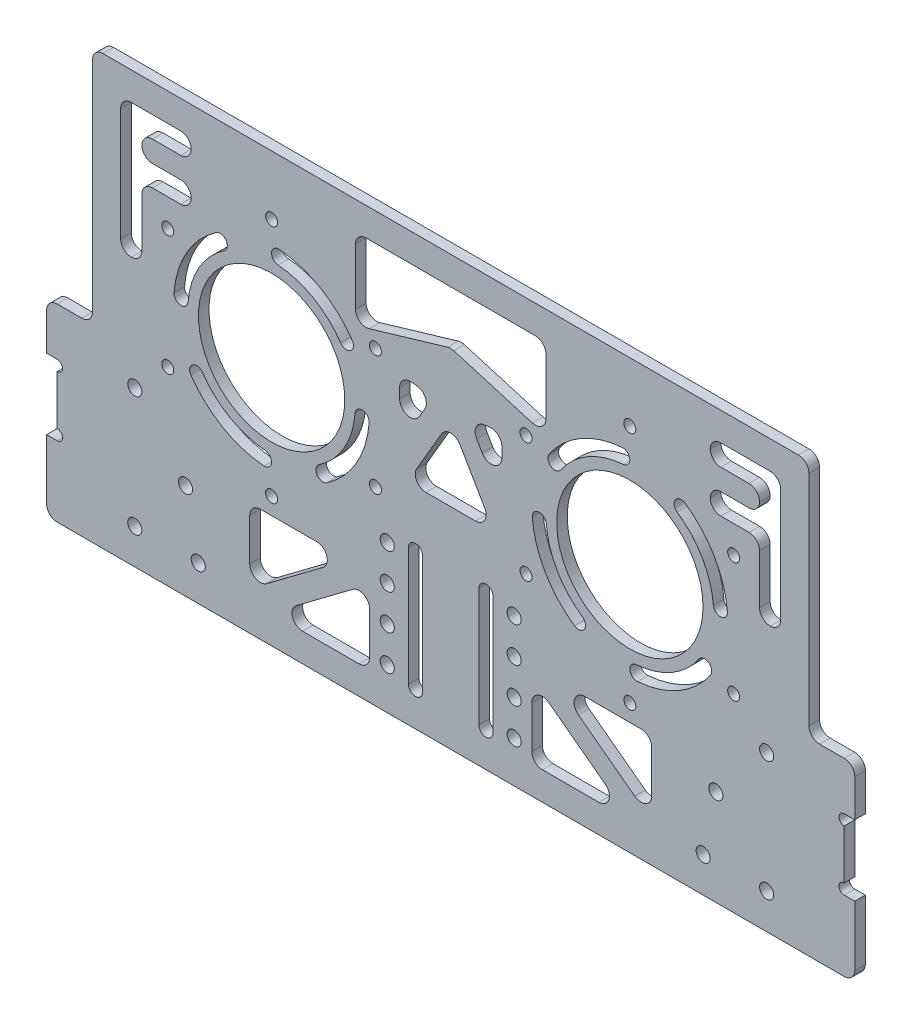
from build123d import *

# Parameters (mm, degrees)
SKETCH_1_W          = 203.2
SKETCH_1_H          = 121.6
EXTRUDE_1_DEPTH     = 3
CUT_EXTRUDE_1_REACH = 120.441
SKETCH_5_R          = 20.75
SKETCH_5_R_2        = 1.7
SKETCH_6_W          = 3
SKETCH_6_H          = 53.59
EXTRUDE_2_DEPTH     = 13
SKETCH_7_W          = 3
SKETCH_7_H          = 53.59
EXTRUDE_3_DEPTH     = 13
FILLET_1_R          = 3
SKETCH_9_R          = 2
CUT_EXTRUDE_2_DEPTH = 130.764401898
FILLET_2_R          = 3
CUT_EXTRUDE_3_DEPTH = 130.764401898
FILLET_3_R          = 3


with BuildPart() as part:
    # 草图1 → 凸台-拉伸1 (new body)
    with BuildSketch(Plane.XY):
        Rectangle(SKETCH_1_W, SKETCH_1_H)
    extrude(amount=-EXTRUDE_1_DEPTH)

    # 草图5 → 切除-拉伸1 (cut, up to next)
    with BuildSketch(Plane.XY, mode=Mode.PRIVATE) as cut_extrude_1_sk1:
        with Locations((-50.8, 10)):
            Circle(SKETCH_5_R)
    cut_extrude_1_tool1 = extrude(cut_extrude_1_sk1.sketch, amount=-CUT_EXTRUDE_1_REACH, mode=Mode.PRIVATE) & part.part
    # 草图5 → 切除-拉伸1 (cut, up to next)
    with BuildSketch(Plane.XY, mode=Mode.PRIVATE) as cut_extrude_1_sk2:
        with Locations((50.8, 10)):
            Circle(SKETCH_5_R)
    cut_extrude_1_tool2 = extrude(cut_extrude_1_sk2.sketch, amount=-CUT_EXTRUDE_1_REACH, mode=Mode.PRIVATE) & part.part
    # 草图5 → 切除-拉伸1 (cut, up to next)
    with BuildSketch(Plane.XY, mode=Mode.PRIVATE) as cut_extrude_1_sk3:
        with Locations((-50.8, 44.000079294)):
            Circle(SKETCH_5_R_2)
    cut_extrude_1_tool3 = extrude(cut_extrude_1_sk3.sketch, amount=-CUT_EXTRUDE_1_REACH, mode=Mode.PRIVATE) & part.part
    # 草图5 → 切除-拉伸1 (cut, up to next)
    with BuildSketch(Plane.XY, mode=Mode.PRIVATE) as cut_extrude_1_sk4:
        with Locations((-21.3550676, 27.000039647)):
            Circle(SKETCH_5_R_2)
    cut_extrude_1_tool4 = extrude(cut_extrude_1_sk4.sketch, amount=-CUT_EXTRUDE_1_REACH, mode=Mode.PRIVATE) & part.part
    # 草图5 → 切除-拉伸1 (cut, up to next)
    with BuildSketch(Plane.XY, mode=Mode.PRIVATE) as cut_extrude_1_sk5:
        with Locations((-21.3550676, -7.000039647)):
            Circle(SKETCH_5_R_2)
    cut_extrude_1_tool5 = extrude(cut_extrude_1_sk5.sketch, amount=-CUT_EXTRUDE_1_REACH, mode=Mode.PRIVATE) & part.part
    # 草图5 → 切除-拉伸1 (cut, up to next)
    with BuildSketch(Plane.XY, mode=Mode.PRIVATE) as cut_extrude_1_sk6:
        with Locations((-50.8, -24.000079294)):
            Circle(SKETCH_5_R_2)
    cut_extrude_1_tool6 = extrude(cut_extrude_1_sk6.sketch, amount=-CUT_EXTRUDE_1_REACH, mode=Mode.PRIVATE) & part.part
    # 草图5 → 切除-拉伸1 (cut, up to next)
    with BuildSketch(Plane.XY, mode=Mode.PRIVATE) as cut_extrude_1_sk7:
        with Locations((-80.2449324, -7.000039647)):
            Circle(SKETCH_5_R_2)
    cut_extrude_1_tool7 = extrude(cut_extrude_1_sk7.sketch, amount=-CUT_EXTRUDE_1_REACH, mode=Mode.PRIVATE) & part.part
    # 草图5 → 切除-拉伸1 (cut, up to next)
    with BuildSketch(Plane.XY, mode=Mode.PRIVATE) as cut_extrude_1_sk8:
        with Locations((-80.2449324, 27.000039647)):
            Circle(SKETCH_5_R_2)
    cut_extrude_1_tool8 = extrude(cut_extrude_1_sk8.sketch, amount=-CUT_EXTRUDE_1_REACH, mode=Mode.PRIVATE) & part.part
    # 草图5 → 切除-拉伸1 (cut, up to next)
    with BuildSketch(Plane.XY, mode=Mode.PRIVATE) as cut_extrude_1_sk9:
        with Locations((50.8, 44)):
            Circle(SKETCH_5_R_2)
    cut_extrude_1_tool9 = extrude(cut_extrude_1_sk9.sketch, amount=-CUT_EXTRUDE_1_REACH, mode=Mode.PRIVATE) & part.part
    # 草图5 → 切除-拉伸1 (cut, up to next)
    with BuildSketch(Plane.XY, mode=Mode.PRIVATE) as cut_extrude_1_sk10:
        with Locations((80.244863729, 27)):
            Circle(SKETCH_5_R_2)
    cut_extrude_1_tool10 = extrude(cut_extrude_1_sk10.sketch, amount=-CUT_EXTRUDE_1_REACH, mode=Mode.PRIVATE) & part.part
    # 草图5 → 切除-拉伸1 (cut, up to next)
    with BuildSketch(Plane.XY, mode=Mode.PRIVATE) as cut_extrude_1_sk11:
        with Locations((80.244863729, -7)):
            Circle(SKETCH_5_R_2)
    cut_extrude_1_tool11 = extrude(cut_extrude_1_sk11.sketch, amount=-CUT_EXTRUDE_1_REACH, mode=Mode.PRIVATE) & part.part
    # 草图5 → 切除-拉伸1 (cut, up to next)
    with BuildSketch(Plane.XY, mode=Mode.PRIVATE) as cut_extrude_1_sk12:
        with Locations((50.8, -24)):
            Circle(SKETCH_5_R_2)
    cut_extrude_1_tool12 = extrude(cut_extrude_1_sk12.sketch, amount=-CUT_EXTRUDE_1_REACH, mode=Mode.PRIVATE) & part.part
    # 草图5 → 切除-拉伸1 (cut, up to next)
    with BuildSketch(Plane.XY, mode=Mode.PRIVATE) as cut_extrude_1_sk13:
        with Locations((21.355136271, -7)):
            Circle(SKETCH_5_R_2)
    cut_extrude_1_tool13 = extrude(cut_extrude_1_sk13.sketch, amount=-CUT_EXTRUDE_1_REACH, mode=Mode.PRIVATE) & part.part
    # 草图5 → 切除-拉伸1 (cut, up to next)
    with BuildSketch(Plane.XY, mode=Mode.PRIVATE) as cut_extrude_1_sk14:
        with Locations((21.355136271, 27)):
            Circle(SKETCH_5_R_2)
    cut_extrude_1_tool14 = extrude(cut_extrude_1_sk14.sketch, amount=-CUT_EXTRUDE_1_REACH, mode=Mode.PRIVATE) & part.part
    add(cut_extrude_1_tool1.solids().sort_by_distance((-50.8, 10, 0))[0], mode=Mode.SUBTRACT)
    add(cut_extrude_1_tool2.solids().sort_by_distance((50.8, 10, 0))[0], mode=Mode.SUBTRACT)
    add(cut_extrude_1_tool3.solids().sort_by_distance((-50.8, 44.000079, 0))[0], mode=Mode.SUBTRACT)
    add(cut_extrude_1_tool4.solids().sort_by_distance((-21.355068, 27.00004, 0))[0], mode=Mode.SUBTRACT)
    add(cut_extrude_1_tool5.solids().sort_by_distance((-21.355068, -7.00004, 0))[0], mode=Mode.SUBTRACT)
    add(cut_extrude_1_tool6.solids().sort_by_distance((-50.8, -24.000079, 0))[0], mode=Mode.SUBTRACT)
    add(cut_extrude_1_tool7.solids().sort_by_distance((-80.244932, -7.00004, 0))[0], mode=Mode.SUBTRACT)
    add(cut_extrude_1_tool8.solids().sort_by_distance((-80.244932, 27.00004, 0))[0], mode=Mode.SUBTRACT)
    add(cut_extrude_1_tool9.solids().sort_by_distance((50.8, 44, 0))[0], mode=Mode.SUBTRACT)
    add(cut_extrude_1_tool10.solids().sort_by_distance((80.244864, 27, 0))[0], mode=Mode.SUBTRACT)
    add(cut_extrude_1_tool11.solids().sort_by_distance((80.244864, -7, 0))[0], mode=Mode.SUBTRACT)
    add(cut_extrude_1_tool12.solids().sort_by_distance((50.8, -24, 0))[0], mode=Mode.SUBTRACT)
    add(cut_extrude_1_tool13.solids().sort_by_distance((21.355136, -7, 0))[0], mode=Mode.SUBTRACT)
    add(cut_extrude_1_tool14.solids().sort_by_distance((21.355136, 27, 0))[0], mode=Mode.SUBTRACT)

    # 草图6 → 凸台-拉伸2 (add)
    with BuildSketch(Plane.ZY.offset(101.6)):
        with Locations((-1.5, -34.005)):
            Rectangle(SKETCH_6_W, SKETCH_6_H)
    extrude(amount=EXTRUDE_2_DEPTH)

    # 草图7 → 凸台-拉伸3 (add)
    with BuildSketch(Plane(origin=(101.6, 0, 0), x_dir=(0, 0, -1), z_dir=(1, 0, 0))):
        with Locations((1.5, -34.005)):
            Rectangle(SKETCH_7_W, SKETCH_7_H)
    extrude(amount=EXTRUDE_3_DEPTH)

    # 圆角1
    fillet_1_edges = [part.edges().sort_by_distance(p)[0] for p in [
        (-101.6, -7.21, -1.5),
        (-101.6, 60.8, -1.5),
        (101.6, 60.8, -1.5),
        (101.6, -7.21, -1.5),
    ]]
    fillet(fillet_1_edges, radius=FILLET_1_R)

    # 草图9 → 切除-拉伸2 (cut, through all)
    with BuildSketch(Plane(origin=(0, 0, -3), x_dir=(-1, 0, 0), z_dir=(0, 0, -1))):
        with Locations((71.6, -50.8)):
            Circle(SKETCH_9_R)
        with Locations((75.189185504, -33.621628993)):
            Circle(SKETCH_9_R)
        with Locations((89.6, -16.8)):
            Circle(SKETCH_9_R)
        with Locations((18, -19.005089604)):
            Circle(SKETCH_9_R)
        with Locations((18, -29.005089604)):
            Circle(SKETCH_9_R)
        with Locations((18, -39.005089604)):
            Circle(SKETCH_9_R)
        with Locations((18, -49.005089604)):
            Circle(SKETCH_9_R)
        with Locations((-18, -49.005089604)):
            Circle(SKETCH_9_R)
        with Locations((-18, -39.005089604)):
            Circle(SKETCH_9_R)
        with Locations((-18, -19.005089604)):
            Circle(SKETCH_9_R)
        with Locations((-18, -29.005089604)):
            Circle(SKETCH_9_R)
        with Locations((-71.6, -50.8)):
            Circle(SKETCH_9_R)
        with Locations((-75.189185504, -33.621628993)):
            Circle(SKETCH_9_R)
        with Locations((-89.6, -16.8)):
            Circle(SKETCH_9_R)
        with Locations((-89.6, -50.8)):
            Circle(SKETCH_9_R)
        with Locations((89.6, -50.8)):
            Circle(SKETCH_9_R)
        Polygon((0, 19.846095433), (12.276889003, -1.2), (-12.276889003, -1.2), align=None)
        Polygon((-27, 52.8), (27, 52.8), (27, 29.815583262), (0, 37.8), (-27, 29.815583262), align=None)
        Polygon((-93.6, 14.8), (-93.6, 52.8), (-73.6, 52.8), (-73.6, 46.8), (-87.6, 46.8), (-87.6, 40.8), (-73.6, 40.8), (-73.6, 34.8), (-87.6, 34.8), (-87.6, 14.8), align=None)
        with BuildLine():
            Line((38, -28.8), (54, -28.8))
            ThreePointArc((54, -28.8), (56.121320344, -29.678679656), (57, -31.8))
            Line((57, -31.8), (57, -43.8))
            ThreePointArc((57, -43.8), (55.341640786, -46.483281573), (52.2, -46.2))
            Line((52.2, -46.2), (36.2, -34.2))
            ThreePointArc((36.2, -34.2), (35.153950106, -30.851316702), (38, -28.8))
        make_face()
        with BuildLine():
            Line((23, -49.8), (23, -37.8))
            ThreePointArc((23, -37.8), (24.658359214, -35.116718427), (27.8, -35.4))
            Line((27.8, -35.4), (43.8, -47.4))
            ThreePointArc((43.8, -47.4), (44.846049894, -50.748683298), (42, -52.8))
            Line((42, -52.8), (26, -52.8))
            ThreePointArc((26, -52.8), (23.878679656, -51.921320344), (23, -49.8))
        make_face()
        with BuildLine():
            Line((12, -17.210179208), (12, -50.8))
            ThreePointArc((12, -50.8), (10, -52.8), (8, -50.8))
            Line((8, -50.8), (8, -17.210179208))
            ThreePointArc((8, -17.210179208), (10, -15.210179208), (12, -17.210179208))
        make_face()
        with BuildLine():
            Line((-8, -17.210179208), (-8, -50.8))
            ThreePointArc((-8, -50.8), (-10, -52.8), (-12, -50.8))
            Line((-12, -50.8), (-12, -17.210179208))
            ThreePointArc((-12, -17.210179208), (-10, -15.210179208), (-8, -17.210179208))
        make_face()
        with BuildLine():
            Line((-26, -52.8), (-42, -52.8))
            ThreePointArc((-42, -52.8), (-44.846049894, -50.748683298), (-43.8, -47.4))
            Line((-43.8, -47.4), (-27.8, -35.4))
            ThreePointArc((-27.8, -35.4), (-24.658359214, -35.116718427), (-23, -37.8))
            Line((-23, -37.8), (-23, -49.8))
            ThreePointArc((-23, -49.8), (-23.878679656, -51.921320344), (-26, -52.8))
        make_face()
        with BuildLine():
            Line((-54, -28.8), (-38, -28.8))
            ThreePointArc((-38, -28.8), (-35.153950106, -30.851316702), (-36.2, -34.2))
            Line((-36.2, -34.2), (-52.2, -46.2))
            ThreePointArc((-52.2, -46.2), (-55.341640786, -46.483281573), (-57, -43.8))
            Line((-57, -43.8), (-57, -31.8))
            ThreePointArc((-57, -31.8), (-56.121320344, -29.678679656), (-54, -28.8))
        make_face()
        Polygon((14.5, 6.89676171), (14.5, 24.158507917), (4.957323726, 23.255635323), align=None)
        Polygon((-4.957323726, 23.255635323), (-14.5, 24.158507917), (-14.5, 6.89676171), align=None)
        Polygon((87.6, 14.8), (93.6, 14.8), (93.6, 52.8), (73.6, 52.8), (73.6, 46.8), (87.6, 46.8), (87.6, 40.8), (73.6, 40.8), (73.6, 34.8), (87.6, 34.8), align=None)
        with BuildLine():
            ThreePointArc((-37.363350239, -9.583639682), (-30.23189666, -1.875), (-27.121745656, 8.155339806))
            ThreePointArc((-27.121745656, 8.155339806), (-24.97244759, 9.993958261), (-23.133829135, 7.844660194))
            ThreePointArc((-23.133829135, 7.844660194), (-26.767795045, -3.875), (-35.100335542, -12.881936891))
            ThreePointArc((-35.100335542, -12.881936891), (-37.880991495, -12.364295635), (-37.363350239, -9.583639682))
        make_face()
        with BuildLine():
            ThreePointArc((-31.216360318, 23.436649761), (-38.925, 30.56810334), (-48.955339806, 33.678254344))
            ThreePointArc((-48.955339806, 33.678254344), (-50.793958261, 35.82755241), (-48.644660194, 37.666170865))
            ThreePointArc((-48.644660194, 37.666170865), (-36.925, 34.032204955), (-27.918063109, 25.699664458))
            ThreePointArc((-27.918063109, 25.699664458), (-28.435704365, 22.919008505), (-31.216360318, 23.436649761))
        make_face()
        with BuildLine():
            ThreePointArc((73.681936891, -5.699664458), (73.164295635, -2.919008505), (70.383639682, -3.436649761))
            ThreePointArc((70.383639682, -3.436649761), (62.675, -10.56810334), (52.644660194, -13.678254344))
            ThreePointArc((52.644660194, -13.678254344), (50.806041739, -15.82755241), (52.955339806, -17.666170865))
            ThreePointArc((52.955339806, -17.666170865), (64.675, -14.032204955), (73.681936891, -5.699664458))
        make_face()
        with BuildLine():
            ThreePointArc((-70.383639682, -3.436649761), (-62.675, -10.56810334), (-52.644660194, -13.678254344))
            ThreePointArc((-52.644660194, -13.678254344), (-50.806041739, -15.82755241), (-52.955339806, -17.666170865))
            ThreePointArc((-52.955339806, -17.666170865), (-64.675, -14.032204955), (-73.681936891, -5.699664458))
            ThreePointArc((-73.681936891, -5.699664458), (-73.164295635, -2.919008505), (-70.383639682, -3.436649761))
        make_face()
        with BuildLine():
            ThreePointArc((-64.236649761, 29.583639682), (-71.36810334, 21.875), (-74.478254344, 11.844660194))
            ThreePointArc((-74.478254344, 11.844660194), (-76.62755241, 10.006041739), (-78.466170865, 12.155339806))
            ThreePointArc((-78.466170865, 12.155339806), (-74.832204955, 23.875), (-66.499664458, 32.881936891))
            ThreePointArc((-66.499664458, 32.881936891), (-63.719008505, 32.364295635), (-64.236649761, 29.583639682))
        make_face()
        with BuildLine():
            ThreePointArc((35.100335542, -12.881936891), (37.880991495, -12.364295635), (37.363350239, -9.583639682))
            ThreePointArc((37.363350239, -9.583639682), (30.23189666, -1.875), (27.121745656, 8.155339806))
            ThreePointArc((27.121745656, 8.155339806), (24.97244759, 9.993958261), (23.133829135, 7.844660194))
            ThreePointArc((23.133829135, 7.844660194), (26.767795045, -3.875), (35.100335542, -12.881936891))
        make_face()
        with BuildLine():
            ThreePointArc((27.918063109, 25.699664458), (28.435704365, 22.919008505), (31.216360318, 23.436649761))
            ThreePointArc((31.216360318, 23.436649761), (38.925, 30.56810334), (48.955339806, 33.678254344))
            ThreePointArc((48.955339806, 33.678254344), (50.793958261, 35.82755241), (48.644660194, 37.666170865))
            ThreePointArc((48.644660194, 37.666170865), (36.925, 34.032204955), (27.918063109, 25.699664458))
        make_face()
        with BuildLine():
            ThreePointArc((66.499664458, 32.881936891), (63.719008505, 32.364295635), (64.236649761, 29.583639682))
            ThreePointArc((64.236649761, 29.583639682), (71.36810334, 21.875), (74.478254344, 11.844660194))
            ThreePointArc((74.478254344, 11.844660194), (76.62755241, 10.006041739), (78.466170865, 12.155339806))
            ThreePointArc((78.466170865, 12.155339806), (74.832204955, 23.875), (66.499664458, 32.881936891))
        make_face()
    extrude(amount=-CUT_EXTRUDE_2_DEPTH, mode=Mode.SUBTRACT)

    # 圆角2
    fillet_2_edges = [part.edges().sort_by_distance(p)[0] for p in [
        (-14.5, 6.89676171, -1.5),
        (-4.957323726, 23.255635323, -1.5),
        (-14.5, 24.158507917, -1.5),
        (4.957323726, 23.255635323, -1.5),
        (14.5, 24.158507917, -1.5),
        (14.5, 6.89676171, -1.5),
        (12.276889003, -1.2, -1.5),
        (-12.276889003, -1.2, -1.5),
        (-93.6, 14.8, -1.5),
        (-87.6, 14.8, -1.5),
        (-73.6, 40.8, -1.5),
        (-87.6, 34.8, -1.5),
        (-73.6, 34.8, -1.5),
        (-87.6, 40.8, -1.5),
        (-87.6, 46.8, -1.5),
        (-73.6, 46.8, -1.5),
        (-73.6, 52.8, -1.5),
        (-93.6, 52.8, -1.5),
        (-27, 52.8, -1.5),
        (-27, 29.815583262, -1.5),
        (0, 37.8, -1.5),
        (27, 29.815583262, -1.5),
        (27, 52.8, -1.5),
        (93.6, 52.8, -1.5),
        (87.6, 46.8, -1.5),
        (73.6, 46.8, -1.5),
        (73.6, 52.8, -1.5),
        (73.6, 40.8, -1.5),
        (73.6, 34.8, -1.5),
        (87.6, 40.8, -1.5),
        (87.6, 34.8, -1.5),
        (87.6, 14.8, -1.5),
        (93.6, 14.8, -1.5),
        (0, 19.846095433, -1.5),
    ]]
    fillet(fillet_2_edges, radius=FILLET_2_R - 0.0001)  # a hair under: the kernel refuses the full size

    # 草图10 → 切除-拉伸3 (cut, through all)
    with BuildSketch(Plane.XY):
        with BuildLine():
            Line((-114.6, -20.8), (-111.6, -20.8))
            ThreePointArc((-111.6, -20.8), (-110.1, -22.3), (-111.6, -23.8))
            Line((-111.6, -23.8), (-111.6, -37.8))
            ThreePointArc((-111.6, -37.8), (-110.1, -39.3), (-111.6, -40.8))
            Line((-111.6, -40.8), (-114.6, -40.8))
            Line((-114.6, -40.8), (-114.6, -20.8))
        make_face()
        with BuildLine():
            Line((114.6, -20.8), (114.6, -40.8))
            Line((114.6, -40.8), (111.6, -40.8))
            ThreePointArc((111.6, -40.8), (110.1, -39.3), (111.6, -37.8))
            Line((111.6, -37.8), (111.6, -23.8))
            ThreePointArc((111.6, -23.8), (110.1, -22.3), (111.6, -20.8))
            Line((111.6, -20.8), (114.6, -20.8))
        make_face()
    extrude(amount=-CUT_EXTRUDE_3_DEPTH, mode=Mode.SUBTRACT)

    # 圆角3
    fillet_3_edges = [part.edges().sort_by_distance(p)[0] for p in [
        (-114.6, -60.8, -1.5),
        (-114.6, -7.21, -1.5),
        (114.6, -60.8, -1.5),
        (114.6, -7.21, -1.5),
    ]]
    fillet(fillet_3_edges, radius=FILLET_3_R)


solid = part.part
